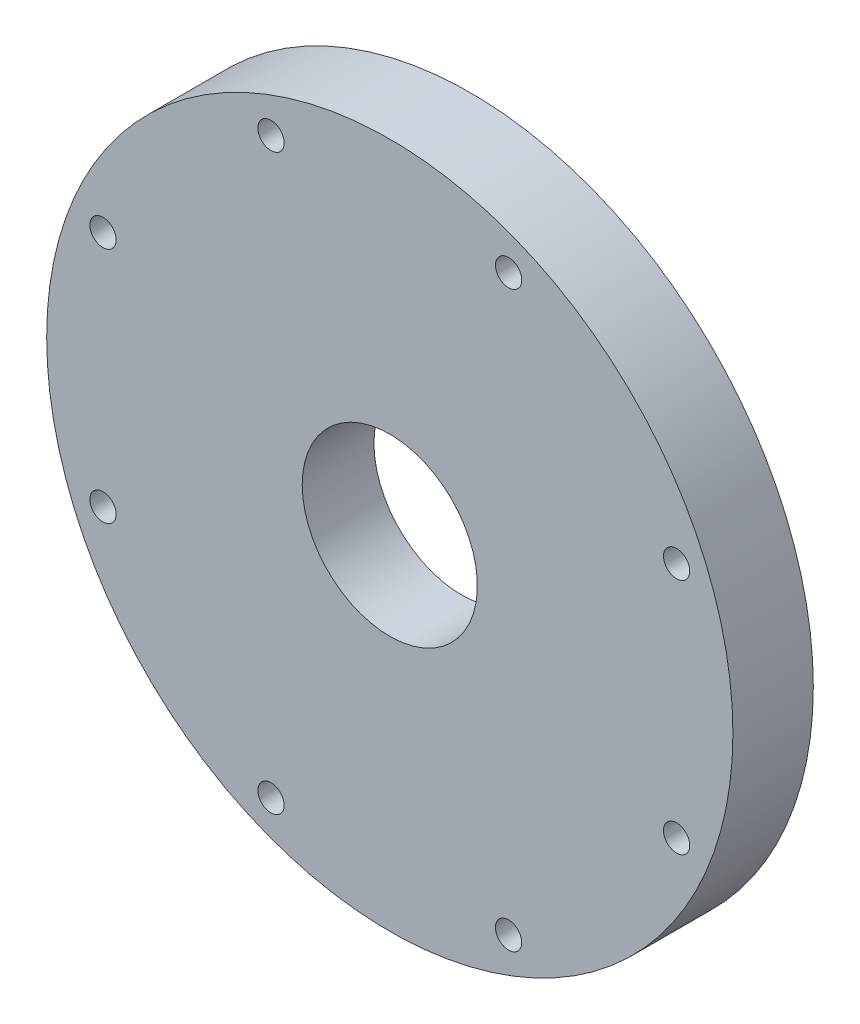
from build123d import *

# Parameters (mm, degrees)
CUT_EXTRUDE2_OUTLINE_R = 47.625
CUT_EXTRUDE2_DEPTH     = 7.234682
F_10_CLEARANCE_HOLE1_D = 5.1054
CIRPATTERN1_COUNT      = 8
CLEARANCING_START      = -7.234682
SKETCH25_R             = 66.675
CLEARANCING_DEPTH      = 7.234682


# Read off the part's stored shape, not the designer's step: Cut-Extrude2
with BuildPart() as part:
    # Sketch24 → Revolve1 (revolve)
    with BuildSketch(Plane(origin=(0, 0, 0), x_dir=(1, 0, 0), z_dir=(0, 1, 0))):
        Polygon((-17.018, -22.86), (-17.018, -8.923782), (-34.42208, -8.923782), (-34.42208, 0), (-47.625, 0), (-47.625, -7.234682), (-46.0375, -7.234682), (-46.0375, -10.371582), (-50.8, -10.371582), (-50.8, -7.234682), (-66.675, -7.234682), (-66.675, -22.86), align=None)
    revolve(axis=Axis((0, 0, -9.275318), (0, 0, 1)))

    # Cut-Extrude2 outline → Cut-Extrude2 (cut)
    with BuildSketch(Plane.XY):
        Circle(CUT_EXTRUDE2_OUTLINE_R)
        with BuildLine():
            add(Edge.make_bspline(
                [(35.948703812, 0), (35.9515816, 0.07538119), (35.957337916, 0.226162951), (35.964207937, 0.452426553), (35.969771157, 0.678783022), (35.978029534, 1.131847853), (35.980843708, 2.190601907), (35.920311441, 3.779931016), (35.747323363, 5.668216834), (35.489928088, 7.474298946), (35.141459932, 9.268877369), (34.702390603, 11.047358984), (34.17343386, 12.80516853), (33.555538624, 14.537761538), (32.849887572, 16.240636382), (32.057893687, 17.909346365), (31.181197352, 19.53951152), (30.221662701, 21.126830276), (29.181373626, 22.667090912), (28.062629225, 24.156182809), (26.867938753, 25.590107465), (25.60001603, 26.964989265), (24.261773335, 28.277085961), (22.856314773, 29.522798851), (21.386929147, 30.698682629), (19.85708232, 31.801454876), (18.270409111, 32.828005175), (16.630704717, 33.775403815), (14.941915703, 34.640910073), (13.208130556, 35.421980041), (11.43356985, 36.116273987), (9.622576022, 36.721663214), (7.779602801, 37.236236415), (5.909204301, 37.658305492), (4.016023818, 37.986410831), (2.104782347, 38.219326014), (0.180266852, 38.356061949), (-1.75268168, 38.395870413), (-3.689180377, 38.338246992), (-5.624316777, 38.182933409), (-7.553161251, 37.929919231), (-9.470779522, 37.579442948), (-11.37224525, 37.131992419), (-13.252652651, 36.588304682), (-15.107129112, 35.949365124), (-16.930847778, 35.216406011), (-18.719040078, 34.390904381), (-20.467008144, 33.474579298), (-22.170137115, 32.469388481), (-23.823907266, 31.377524301), (-25.42390596, 30.201409162), (-26.965839357, 28.943690275), (-28.445543888, 27.607233836), (-29.858997424, 26.195118613), (-31.202330147, 24.710628968), (-32.471835063, 23.157247319), (-33.663978152, 21.538646066), (-34.775408104, 19.858679), (-35.802965645, 18.121372202), (-36.743692396, 16.330914471), (-37.594839261, 14.491647299), (-38.353874308, 12.608054401), (-39.018490139, 10.68475085), (-39.586610697, 8.726471825), (-40.056397525, 6.738061006), (-40.426255434, 4.724458642), (-40.694837576, 2.690689328), (-40.861049894, 0.641849508), (-40.924054953, -1.416905249), (-40.883275123, -3.480373184), (-40.738395114, -5.543319447), (-40.489363842, -7.600489337), (-40.13639564, -9.646621653), (-39.679970776, -11.676462103), (-39.120835312, -13.684776759), (-38.460000265, -15.666365517), (-37.698740094, -17.61607551), (-36.838590511, -19.528814477), (-35.881345602, -21.399564006), (-34.829054288, -23.223392663), (-33.684016107, -24.995468936), (-32.44877635, -26.711073982), (-31.126120537, -28.365614138), (-29.719068263, -29.954633155), (-28.230866416, -31.473824138), (-26.664981791, -32.919041144), (-25.025093105, -34.286310417), (-23.315082441, -35.571841228), (-21.53902614, -36.772036288), (-19.701185153, -37.883501708), (-17.805994889, -38.903056478), (-15.85805457, -39.827741435), (-13.862116128, -40.654827709), (-11.823072667, -41.381824596), (-9.745946518, -42.006486871), (-7.635876912, -42.526821485), (-5.498107312, -42.941093656), (-3.337972426, -43.247832311), (-1.160884928, -43.445834888), (1.027678058, -43.534171454), (3.222188708, -43.512188152), (5.417082419, -43.379509955), (7.606771886, -43.136042707), (9.785661288, -42.781974466), (11.948160555, -42.317776118), (14.08869967, -41.74420128), (16.201742982, -41.062285471), (18.281803484, -40.273344558), (20.323457017, -39.378972487), (22.321356376, -38.381038284), (24.27024527, -37.281682345), (26.164972102, -36.083312015), (28.000503535, -34.788596469), (29.77193781, -33.400460899), (31.474517775, -31.92208003), (33.103643596, -30.356870964), (34.654885111, -28.708485383), (36.123993806, -26.980801118), (37.506914359, -25.17791311), (38.799795742, -23.304123775), (39.999001844, -21.363932809), (41.101121576, -19.362026441), (41.938186302, -17.641904891), (42.402189205, -16.588613759), (42.554027377, -16.231646763)],
                knots=[0, 0, 0, 0, 0.000879209, 0.001758645, 0.002638305, 0.003518191, 0.007039982, 0.014977213, 0.022047939, 0.029133237, 0.036233164, 0.043347773, 0.050477114, 0.057621232, 0.06478017, 0.071953969, 0.079142669, 0.086346306, 0.093564916, 0.100798534, 0.108047194, 0.115310927, 0.122589766, 0.12988374, 0.13719288, 0.144517215, 0.151856774, 0.159211583, 0.16658167, 0.173967063, 0.181367786, 0.188783866, 0.196215328, 0.203662198, 0.211124498, 0.218602253, 0.226095488, 0.233604225, 0.241128486, 0.248668296, 0.256223676, 0.263794648, 0.271381234, 0.278983456, 0.286601335, 0.294234891, 0.301884146, 0.309549121, 0.317229835, 0.324926308, 0.332638561, 0.340366614, 0.348110485, 0.355870195, 0.363645762, 0.371437205, 0.379244543, 0.387067795, 0.39490698, 0.402762115, 0.410633219, 0.41852031, 0.426423405, 0.434342523, 0.442277682, 0.450228898, 0.458196189, 0.466179572, 0.474179065, 0.482194684, 0.490226447, 0.498274369, 0.506338468, 0.514418761, 0.522515263, 0.530627991, 0.538756962, 0.546902191, 0.555063694, 0.563241488, 0.571435588, 0.57964601, 0.58787277, 0.596115883, 0.604375364, 0.61265123, 0.620943495, 0.629252175, 0.637577285, 0.64591884, 0.654276855, 0.662651345, 0.671042324, 0.679449808, 0.687873812, 0.696314349, 0.704771435, 0.713245083, 0.721735309, 0.730242127, 0.738765551, 0.747305595, 0.755862273, 0.7644356, 0.77302559, 0.781632256, 0.790255613, 0.798895674, 0.807552454, 0.816225965, 0.824916222, 0.833623239, 0.842347028, 0.851087604, 0.859844979, 0.868619169, 0.877410184, 0.88621804, 0.895042749, 0.903884325, 0.912742781, 0.921618129, 0.930510383, 0.935031581, 0.935031581, 0.935031581, 0.935031581], degree=3))
            ThreePointArc((35.948703812, 0), (36.836858206, -3.871377871), (39.552581276, -6.769865934))
            ThreePointArc((39.552581276, -6.769865934), (42.805320101, -10.94498561), (42.554027377, -16.231646763))
        make_face(mode=Mode.SUBTRACT)
    extrude(amount=CUT_EXTRUDE2_DEPTH, mode=Mode.SUBTRACT)

    # #10 Clearance Hole1 (through all)
    with Locations(Plane(origin=(55.733032799, -23.085378057, 7.234682), x_dir=(-1, 0, 0), z_dir=(0, 0, -1))):
        with Locations((0, 0)):
            f_10_clearance_hole1 = Hole(F_10_CLEARANCE_HOLE1_D / 2)

    # CirPattern1: #10 Clearance Hole1 ×8 about axis
    cirpattern1_axis = Axis((0, 0, 0), (0, 0, 1))
    for i in range(1, CIRPATTERN1_COUNT):
        add(f_10_clearance_hole1.rotate(cirpattern1_axis, i * 360 / CIRPATTERN1_COUNT), mode=Mode.SUBTRACT)

    # Sketch25 → Clearancing (cut)
    with BuildSketch(Plane(origin=(0, 0, 0), x_dir=(-1, 0, 0), z_dir=(0, 0, -1)).offset(CLEARANCING_START)):
        Circle(SKETCH25_R)
        with BuildLine():
            ThreePointArc((-39.485738347, -6.87785215), (-42.684264858, -10.983386498), (-42.437160346, -16.181936632))
            add(Edge.make_bspline(
                [(-42.437160346, -16.181936632), (-41.450328446, -18.501948894), (-40.287188075, -20.70386066), (-37.62426385, -24.882183045), (-36.1244575, -26.858578596), (-33.612918368, -29.647784963), (-32.727511557, -30.551787217), (-30.899288351, -32.26713978), (-29.954285679, -33.081629815), (-27.028415852, -35.398073541), (-24.957331886, -36.773902575), (-22.214143518, -38.277928099), (-21.657736444, -38.567871448), (-20.529077868, -39.125607363), (-19.957869924, -39.392805227), (-18.236811973, -40.153613466), (-17.074606136, -40.608998857), (-13.544408375, -41.82291337), (-11.1331575, -42.430323242), (-8.045152005, -42.931279628), (-7.423828634, -43.018467653), (-6.17358737, -43.166313281), (-5.545687994, -43.226778512), (-3.668882092, -43.366672694), (-2.421130233, -43.405411027), (1.311985825, -43.361475459), (3.787286298, -43.119848136), (7.47956464, -42.43089353), (8.712476258, -42.144649273), (11.128372813, -41.470614218), (12.31452175, -41.08278751), (15.808874803, -39.769919796), (18.053477953, -38.696639775), (21.289209419, -36.780985477), (22.349089848, -36.088250708), (24.383348169, -34.625595136), (25.362502881, -33.853290457), (28.188051648, -31.415612474), (29.923427118, -29.630442917), (31.900539288, -27.191684875), (32.287236817, -26.69215724), (33.03483793, -25.679954076), (33.395921295, -25.167211132), (34.441621812, -23.609372602), (35.088773016, -22.544710991), (36.882357275, -19.273503621), (37.882174946, -16.990390194), (38.875744828, -14.00270068), (39.061155114, -13.399331831), (39.402369545, -12.191519857), (39.558676578, -11.585611614), (39.985275792, -9.761961138), (40.441402975, -7.314651304), (40.674139412, -4.836063161), (40.763559938, -2.965202227), (40.779154388, -2.339591952), (40.781417609, -1.08432134), (40.76799572, -0.453052442), (40.627903307, 2.692390804), (40.286121576, 5.161443437), (39.43890774, 8.796132878), (39.100388573, 9.996140785), (38.308399323, 12.37248564), (37.852097598, 13.554391573), (36.333140039, 16.997228128), (35.119491675, 19.170506242), (33.001368487, 22.2498484), (32.245396403, 23.246004252), (31.033998954, 24.693258097), (30.616682544, 25.168342498), (29.765008734, 26.092546286), (29.329638676, 26.542937105), (27.105848432, 28.737227444), (25.177853658, 30.309665479), (22.580283298, 32.044782733), (22.051311937, 32.380188303), (20.974087609, 33.027312806), (20.424315753, 33.339806048), (18.760945416, 34.232685111), (17.631513907, 34.770110987), (14.183245166, 36.213360105), (11.805002439, 36.951757683), (8.729750366, 37.586018139), (8.107774126, 37.698555851), (6.863218919, 37.892276195), (6.240962177, 37.973521872), (4.374253461, 38.171221637), (1.88547224, 38.31227114), (-0.602985761, 38.211399864), (-2.469206159, 38.043607473), (-3.091259068, 37.972290691), (-4.335323004, 37.798308656), (-4.959105867, 37.695274824), (-8.05217871, 37.104825218), (-10.442064996, 36.396124759), (-13.903223174, 34.987468388), (-15.036178129, 34.459888971), (-16.703458261, 33.578668593), (-17.255286668, 33.26900823), (-18.337021034, 32.625547889), (-18.867738625, 32.291418051), (-21.471435266, 30.559817088), (-23.396215015, 28.98129219), (-25.602702171, 26.764423917), (-26.03392942, 26.30874761), (-26.875809699, 25.372259656), (-27.286623762, 24.891064324), (-28.473720562, 23.426447254), (-29.209796712, 22.416679591), (-31.255817918, 19.289573594), (-32.405286999, 17.075476116), (-33.791719154, 13.550670272), (-34.189829991, 12.359597052), (-34.85899573, 9.95467515), (-35.402182987, 7.524154989), (-35.69403317, 5.042564271), (-35.815892674, 3.161655555), (-35.840306869, 2.530241223), (-35.855853683, 1.267408077), (-35.845894895, 0.636088005), (-35.821796258, 0.004844883)],
                knots=[0, 0, 0, 0, 0.03125, 0.03125, 0.0625, 0.0625, 0.078125, 0.078125, 0.09375, 0.09375, 0.125, 0.125, 0.1328125, 0.1328125, 0.140625, 0.140625, 0.15625, 0.15625, 0.1875, 0.1875, 0.1953125, 0.1953125, 0.203125, 0.203125, 0.21875, 0.21875, 0.25, 0.25, 0.265625, 0.265625, 0.28125, 0.28125, 0.3125, 0.3125, 0.328125, 0.328125, 0.34375, 0.34375, 0.375, 0.375, 0.3828125, 0.3828125, 0.390625, 0.390625, 0.40625, 0.40625, 0.4375, 0.4375, 0.4453125, 0.4453125, 0.453125, 0.453125, 0.46875, 0.484375, 0.484375, 0.4921875, 0.4921875, 0.5, 0.5, 0.53125, 0.53125, 0.546875, 0.546875, 0.5625, 0.5625, 0.59375, 0.59375, 0.609375, 0.609375, 0.6171875, 0.6171875, 0.625, 0.625, 0.65625, 0.65625, 0.6640625, 0.6640625, 0.671875, 0.671875, 0.6875, 0.6875, 0.71875, 0.71875, 0.7265625, 0.7265625, 0.734375, 0.734375, 0.75, 0.765625, 0.765625, 0.7734375, 0.7734375, 0.78125, 0.78125, 0.8125, 0.8125, 0.828125, 0.828125, 0.8359375, 0.8359375, 0.84375, 0.84375, 0.875, 0.875, 0.8828125, 0.8828125, 0.890625, 0.890625, 0.90625, 0.90625, 0.9375, 0.9375, 0.953125, 0.953125, 0.96875, 0.984375, 0.984375, 0.9921875, 0.9921875, 1, 1, 1, 1], degree=3))
            ThreePointArc((-35.821796258, 0.004844883), (-36.724753226, -3.931055952), (-39.485738347, -6.87785215))
        make_face(mode=Mode.SUBTRACT)
    extrude(amount=CLEARANCING_DEPTH, mode=Mode.SUBTRACT)


solid = part.part
